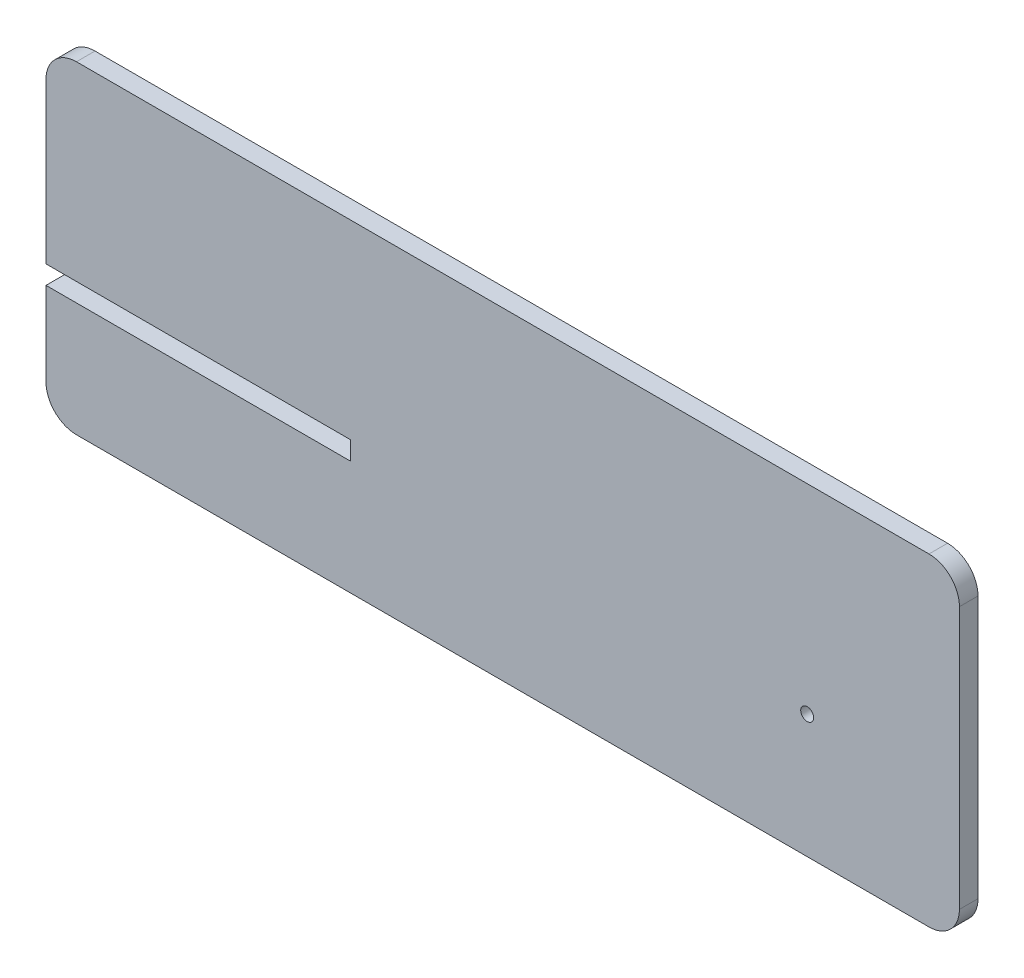
from build123d import *

# Parameters (mm, degrees)
BOSS_EXTRUDE1_DEPTH = 3.0988
SKETCH3_R           = 1.0795
BOSS_EXTRUDE2_DEPTH = 3.0988
FILLET1_R           = 5.08


with BuildPart() as part:
    # Sketch2 → Boss-Extrude1 (new body)
    with BuildSketch(Plane.XY):
        Polygon((-50.8, 1.5494), (-50.8, 7.8994), (50.8, 7.8994), (50.8, -7.8994), (-50.8, -7.8994), (-50.8, -1.5494), (0, -1.5494), (0, 1.5494), align=None)
    extrude(amount=BOSS_EXTRUDE1_DEPTH)

    # Sketch3 → Boss-Extrude2 (add)
    with BuildSketch(Plane.XY):
        Polygon((50.8, -7.8994), (-50.8, -7.8994), (-50.8, -20.5994), (101.6, -20.5994), (101.6, 33.2994), (-50.8, 33.2994), (-50.8, 7.8994), (50.8, 7.8994), align=None)
        with Locations((76.2, 0)):
            Circle(SKETCH3_R, mode=Mode.SUBTRACT)
    extrude(amount=BOSS_EXTRUDE2_DEPTH)

    # Fillet1
    fillet1_edges = [part.edges().sort_by_distance(p)[0] for p in [
        (101.6, -20.5994, 1.5494),
        (-50.8, -20.5994, 1.5494),
        (-50.8, 33.2994, 1.5494),
        (101.6, 33.2994, 1.5494),
    ]]
    fillet(fillet1_edges, radius=FILLET1_R)


solid = part.part
